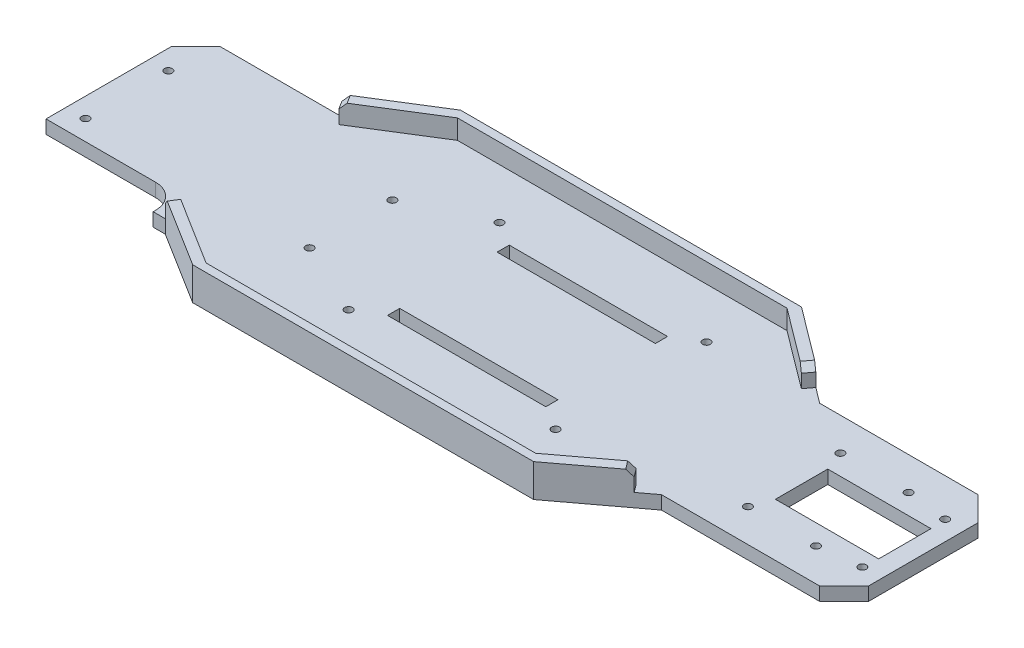
from build123d import *

# Parameters (mm, degrees)
BOSS_EXTRUDE1_DEPTH  = 5.5
CHASSIS_WALLS1_DEPTH = 8
CHAMFER1_SIZE        = 10
CHAMFER2_SIZE        = 10
CHAMFER3_SIZE        = 2.5
SKETCH4_R            = 1.6
CUT_EXTRUDE1_DEPTH   = 10
SKETCH5_W            = 55
SKETCH5_H            = 11
CUT_EXTRUDE2_DEPTH   = 10
SKETCH6_W            = 65
SKETCH6_H            = 5
CUT_EXTRUDE3_DEPTH   = 184.613724977
FILLET1_R            = 10
SKETCH7_W            = 42.4
SKETCH7_H            = 21.5
CUT_EXTRUDE4_DEPTH   = 184.613724977
SKETCH9_R            = 1.6
CUT_EXTRUDE5_DEPTH   = 184.613724977


with BuildPart() as part:
    # Sketch1 → Boss-Extrude1 (new body)
    with BuildSketch(Plane(origin=(0, 0, 0), x_dir=(1, 0, 0), z_dir=(0, 1, 0))):
        Polygon((-100, 36.25), (-70, 55), (70, 55), (100, 32.5), (175, 32.5), (175, -32.5), (100, -32.5), (70, -55), (-70, -55), (-100, -36.25), (-160, -36.25), (-160, 36.25), align=None)
    extrude(amount=BOSS_EXTRUDE1_DEPTH)

    # Sketch3 → Chassis-Walls1 (add)
    with BuildSketch(Plane(origin=(0, 5.5, 0), x_dir=(1, 0, 0), z_dir=(0, 1, 0))):
        Polygon((0, 55), (-70, 55), (-100, 36.25), (-97.88000424, 32.858006784), (-67.88000424, 51.608006784), (0, 51.608006784), (67.456005088, 51.608006784), (91.056005088, 33.908006784), (93.6, 37.3), (70, 55), align=None)
        Polygon((67.456005088, -51.608006784), (0, -51.608006784), (-67.88000424, -51.608006784), (-97.88000424, -32.858006784), (-100, -36.25), (-70, -55), (0, -55), (70, -55), (93.6, -37.3), (91.056005088, -33.908006784), align=None)
    extrude(amount=CHASSIS_WALLS1_DEPTH)

    # Chamfer1
    chamfer1_edges = [part.edges().sort_by_distance(p)[0] for p in [
        (-160, 2.75, -36.25),
        (-160, 2.75, 36.25),
    ]]
    chamfer(chamfer1_edges, length=CHAMFER1_SIZE)

    # Chamfer2
    chamfer2_edges = [part.edges().sort_by_distance(p)[0] for p in [
        (175, 2.75, -32.5),
        (175, 2.75, 32.5),
    ]]
    chamfer(chamfer2_edges, length=CHAMFER2_SIZE)

    # Chamfer3
    chamfer3_edges = [part.edges().sort_by_distance(p)[0] for p in [
        (-98.94000212, 13.5, -34.554003392),
        (92.328002544, 13.5, -35.604003392),
        (-98.94000212, 13.5, 34.554003392),
        (92.328002544, 13.5, 35.604003392),
    ]]
    chamfer(chamfer3_edges, length=CHAMFER3_SIZE)

    # Sketch4 → Cut-Extrude1 (cut)
    with BuildSketch(Plane.XZ):
        with Locations((-152, 17)):
            Circle(SKETCH4_R)
        with Locations((-60, 17)):
            Circle(SKETCH4_R)
        with Locations((-60, -17)):
            Circle(SKETCH4_R)
        with Locations((-152, -17)):
            Circle(SKETCH4_R)
        with Locations((-30, 31)):
            Circle(SKETCH4_R)
        with Locations((55, 31)):
            Circle(SKETCH4_R)
        with Locations((55, -31)):
            Circle(SKETCH4_R)
        with Locations((-30, -31)):
            Circle(SKETCH4_R)
    extrude(amount=-CUT_EXTRUDE1_DEPTH, mode=Mode.SUBTRACT)

    # Sketch5 → Cut-Extrude2 (cut)
    with BuildSketch(Plane(origin=(0, 5.5, 0), x_dir=(1, 0, 0), z_dir=(0, 1, 0))):
        with Locations((-132.5, -30.75)):
            Rectangle(SKETCH5_W, SKETCH5_H)
    extrude(amount=-CUT_EXTRUDE2_DEPTH, mode=Mode.SUBTRACT)

    # Sketch6 → Cut-Extrude3 (cut, through all)
    with BuildSketch(Plane(origin=(0, 5.5, 0), x_dir=(1, 0, 0), z_dir=(0, 1, 0))):
        with Locations((12.5, 22.5)):
            Rectangle(SKETCH6_W, SKETCH6_H)
        with Locations((12.5, -22.5)):
            Rectangle(SKETCH6_W, SKETCH6_H)
    extrude(amount=-CUT_EXTRUDE3_DEPTH, mode=Mode.SUBTRACT)

    # Fillet1
    fillet1_edges = [part.edges().sort_by_distance(p)[0] for p in [
        (-105, 2.75, 25.25),
    ]]
    fillet(fillet1_edges, radius=FILLET1_R)

    # Sketch7 → Cut-Extrude4 (cut, through all)
    with BuildSketch(Plane(origin=(0, 5.5, 0), x_dir=(1, 0, 0), z_dir=(0, 1, 0))):
        with Locations((146.25, 0)):
            Rectangle(SKETCH7_W, SKETCH7_H)
    extrude(amount=-CUT_EXTRUDE4_DEPTH, mode=Mode.SUBTRACT)

    # Sketch9 → Cut-Extrude5 (cut, through all)
    with BuildSketch(Plane(origin=(0, 5.5, 0), x_dir=(1, 0, 0), z_dir=(0, 1, 0))):
        with Locations((122, -19)):
            Circle(SKETCH9_R)
        with Locations((150, -19)):
            Circle(SKETCH9_R)
        with Locations((167, -17)):
            Circle(SKETCH9_R)
    cut_extrude5 = extrude(amount=-CUT_EXTRUDE5_DEPTH, mode=Mode.SUBTRACT)

    # Mirror1: Cut-Extrude5 across plane
    add(cut_extrude5.mirror(Plane.XY), mode=Mode.SUBTRACT)


solid = part.part
